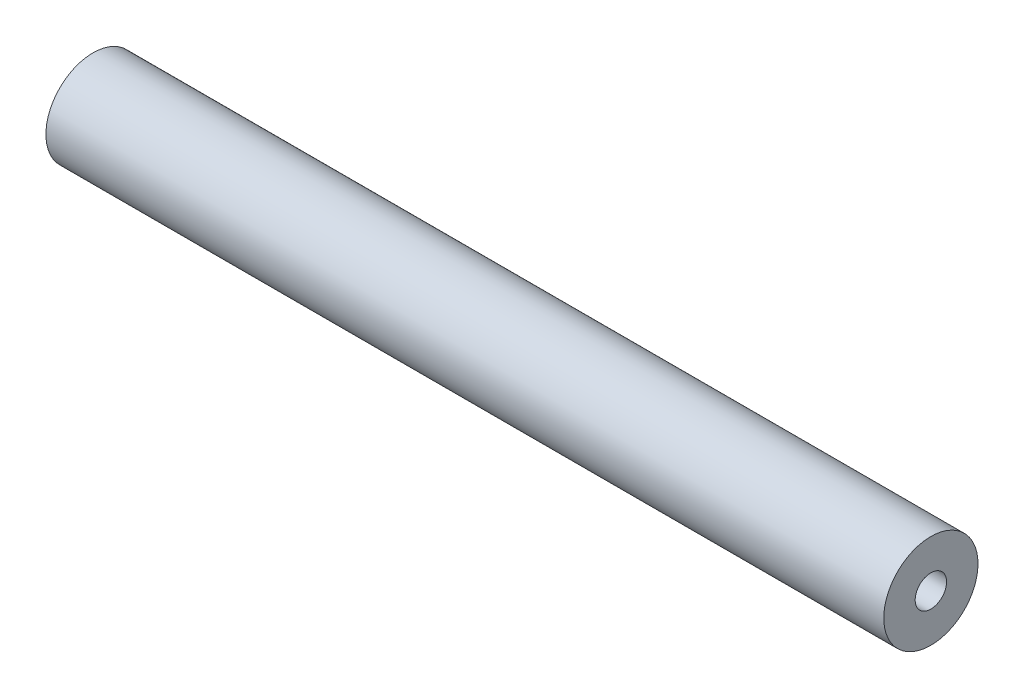
from build123d import *

# Parameters (mm, degrees)
SKIZZE1_R                       = 4.5
AUFSATZ_LINEAR_AUSTRAGEN1_DEPTH = 80
SKIZZE2_R                       = 1.5
SCHNITT_LINEAR_AUSTRAGEN1_DEPTH = 10
SCHNITT_LINEAR_START            = -10
SKIZZE3_R                       = 1.5
SCHNITT_LINEAR_AUSTRAGEN2_DEPTH = 10


with BuildPart() as part:
    # Skizze1 → Aufsatz-Linear austragen1 (new body)
    with BuildSketch(Plane(origin=(0, 0, 0), x_dir=(0, 0, -1), z_dir=(1, 0, 0))):
        Circle(SKIZZE1_R)
    extrude(amount=AUFSATZ_LINEAR_AUSTRAGEN1_DEPTH)

    # Skizze2 → Schnitt-Linear austragen1 (cut)
    with BuildSketch(Plane.ZY):
        Circle(SKIZZE2_R)
    extrude(amount=-SCHNITT_LINEAR_AUSTRAGEN1_DEPTH, mode=Mode.SUBTRACT)

    # Skizze3 → Schnitt-Linear austragen2 (cut)
    with BuildSketch(Plane(origin=(80, 0, 0), x_dir=(0, 0, -1), z_dir=(1, 0, 0)).offset(SCHNITT_LINEAR_START)):
        Circle(SKIZZE3_R)
    extrude(amount=SCHNITT_LINEAR_AUSTRAGEN2_DEPTH, mode=Mode.SUBTRACT)


solid = part.part
